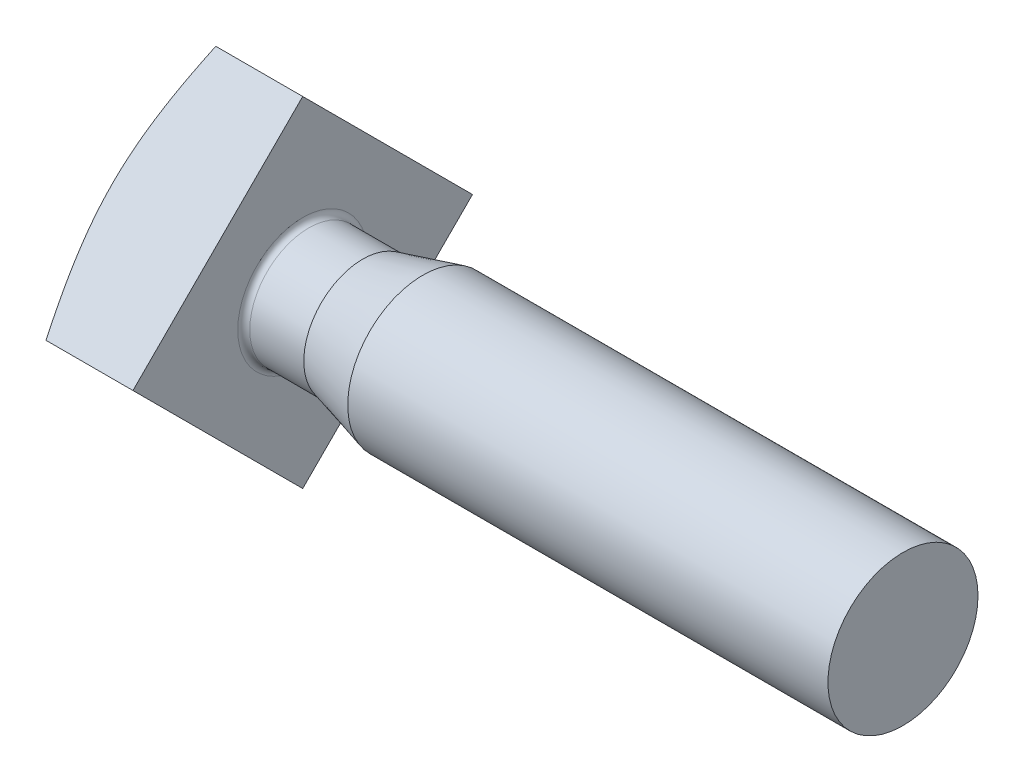
from build123d import *

# Parameters (mm, degrees)
BASEHEAD_DEPTH     = 3.5
SKETCH3_R          = 2.5
BASEBODY_DEPTH     = 20
SKETCH5_R          = 3.6
CUT_EXTRUDE1_DEPTH = 0.7
HEADFILLET1_R      = 0.2


with BuildPart() as part:
    # Sketch2 → BaseHead (new body)
    with BuildSketch(Plane(origin=(0, 0, 0), x_dir=(0, 0, -1), z_dir=(1, 0, 0))):
        Polygon((5.656854249, 0), (0, 5.656854249), (-5.656854249, 0), (0, -5.656854249), align=None)
    extrude(amount=BASEHEAD_DEPTH)

    # Sketch3 → BaseBody (add)
    with BuildSketch(Plane(origin=(3.5, 0, 0), x_dir=(0, 0, -1), z_dir=(1, 0, 0))):
        Circle(SKETCH3_R)
    extrude(amount=BASEBODY_DEPTH)

    # Sketch4 → HeadChamfer (revolve, cut)
    with BuildSketch(Plane.XY):
        Polygon((0, 5.656854249), (0.603045629, 5.656854249), (0, 4), align=None)
    revolve(axis=Axis((-0.779828486, 0, 0), (1, 0, 0)), mode=Mode.SUBTRACT)

    # Sketch5 → Cut-Extrude1 (cut)
    with BuildSketch(Plane.ZY):
        Circle(SKETCH5_R)
    extrude(amount=-CUT_EXTRUDE1_DEPTH, mode=Mode.SUBTRACT)

    # Sketch6 → Cut-Revolve1 (revolve, cut)
    with BuildSketch(Plane.XY):
        Polygon((3.5, 1.964101615), (5.5, 1.964101615), (7.5, 2.5), (3.5, 2.5), align=None)
    revolve(axis=Axis((23.5, 0, 0), (-1, 0, 0)), mode=Mode.SUBTRACT)

    # HeadFillet1
    headfillet1_edges = [part.edges().sort_by_distance(p)[0] for p in [
        (3.5, -1.964101615, 0),
    ]]
    fillet(headfillet1_edges, radius=HEADFILLET1_R)


solid = part.part
